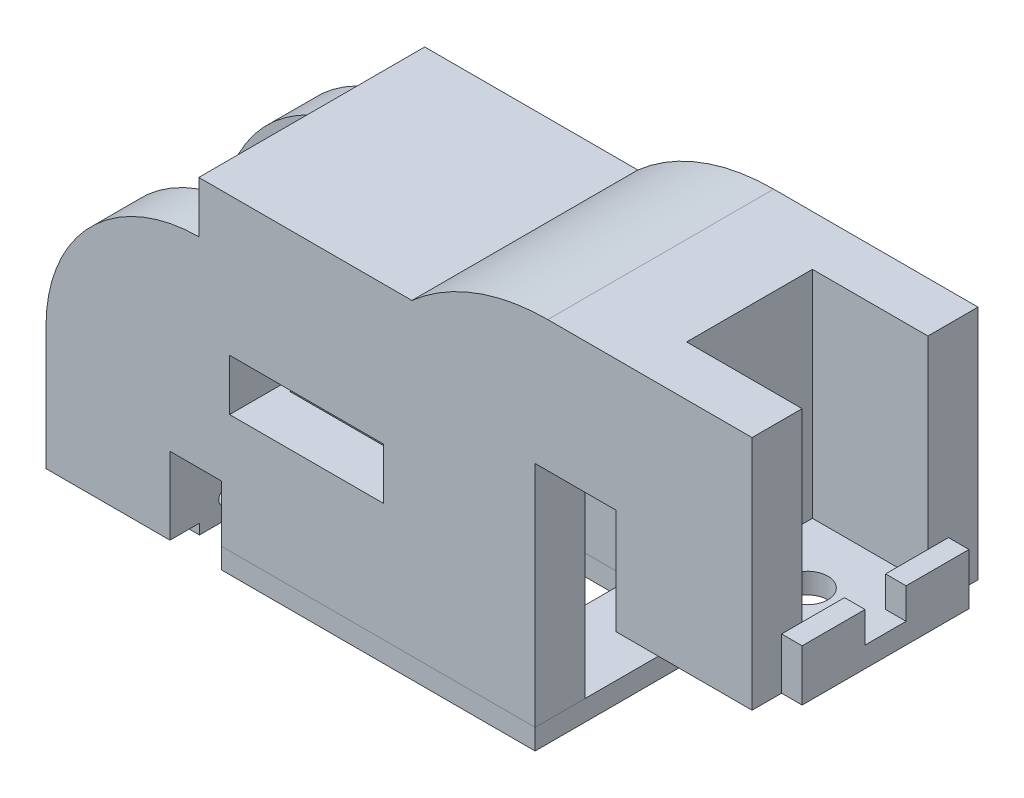
from build123d import *

# Parameters (mm, degrees)
SKETCH1_W              = 47.63
SKETCH1_H              = 22
SKETCH1_W_2            = 5.25
SKETCH1_H_2            = 12.25
BOSS_EXTRUDE1_DEPTH    = 2
SKETCH3_W              = 32.75
SKETCH3_H              = 22
BOSS_EXTRUDE2_DEPTH    = 30
SKETCH2_W              = 28.75
SKETCH2_H              = 12.25
CUT_EXTRUDE1_DEPTH     = 22.25
BOSS_EXTRUDE7_DEPTH    = 25
SKETCH19_W             = 16.25
SKETCH19_H             = 2
BOSS_EXTRUDE8_DEPTH    = 2
SKETCH20_W             = 2
SKETCH20_H             = 16.25
BOSS_EXTRUDE9_DEPTH    = 3
SKETCH39_W             = 4
SKETCH39_H             = 3
CUT_EXTRUDE16_DEPTH    = 2
BOSS_EXTRUDE11_DEPTH   = 28.03
SKETCH10_W             = 5
SKETCH10_H             = 22
CUT_EXTRUDE6_DEPTH     = 7.5
SKETCH21_R             = 0.75
CUT_EXTRUDE12_DEPTH    = 10
SKETCH21_5_R           = 0.75
CUT_EXTRUDE13_DEPTH    = 46.595105
SKETCH10_3_W           = 5
SKETCH10_3_H           = 2.875
SKETCH10_3_H_2         = 3.25
SKETCH10_3_H_3         = 9.75
CUT_EXTRUDE14_DEPTH    = 43.560712224
SKETCH25_W             = 14
SKETCH25_H             = 5
SKETCH25_W_2           = 1
CUT_EXTRUDE15_DEPTH    = 47.630614675
FILLET2_R              = 15
SKETCH29_W             = 9.875
SKETCH29_H             = 22
BOSS_EXTRUDE12_DEPTH   = 7.75
SKETCH30_W             = 11.25
SKETCH30_H             = 4.875
BOSS_EXTRUDE13_DEPTH   = 16
SKETCH36_W             = 13.25
SKETCH36_H             = 22
SKETCH36_R             = 2
BOSS_EXTRUDE16_DEPTH   = 2
SKETCH30_4_W           = 11.25
SKETCH30_4_H           = 4.875
BOSS_EXTRUDE18_DEPTH   = 5
BOSS_EXTRUDE19_DEPTH   = 2
SKETCH29_3_W           = 9.875
SKETCH29_3_H           = 22
BOSS_EXTRUDE20_DEPTH   = 5
SKETCH40_W             = 12
SKETCH40_H             = 22
BOSS_EXTRUDE21_DEPTH   = 5
FILLET5_R              = 20
SPLIT2_SURFACE_1_BACK  = 85.978
SPLIT2_SURFACE_1_DEPTH = 171.956
SPLIT2_SURFACE_2_BACK  = 85.978
SPLIT2_SURFACE_2_DEPTH = 171.956
SKETCH45_R             = 2
CUT_EXTRUDE17_DEPTH    = 60.57653565


with BuildPart() as part:
    # Sketch1 → Boss-Extrude1 (new body)
    with BuildSketch(Plane(origin=(0, 0, 0), x_dir=(1, 0, 0), z_dir=(0, 1, 0))):
        Rectangle(SKETCH1_W, SKETCH1_H)
        with Locations((13.315, 0)):
            Rectangle(SKETCH1_W_2, SKETCH1_H_2, mode=Mode.SUBTRACT)
    extrude(amount=BOSS_EXTRUDE1_DEPTH)

    # Sketch3 → Boss-Extrude2 (add)
    with BuildSketch(Plane(origin=(0, 2, 0), x_dir=(1, 0, 0), z_dir=(0, 1, 0))):
        with Locations((7.44, 0)):
            Rectangle(SKETCH3_W, SKETCH3_H)
    extrude(amount=BOSS_EXTRUDE2_DEPTH)

    # Sketch2 → Cut-Extrude1 (cut)
    with BuildSketch(Plane(origin=(0, 2, 0), x_dir=(1, 0, 0), z_dir=(0, 1, 0))):
        with Locations((9.44, 0)):
            Rectangle(SKETCH2_W, SKETCH2_H)
    extrude(amount=CUT_EXTRUDE1_DEPTH, mode=Mode.SUBTRACT)

    # Sketch18 → Boss-Extrude7 (add)
    with BuildSketch(Plane(origin=(0, 2, 0), x_dir=(1, 0, 0), z_dir=(0, 1, 0))):
        Polygon((-23.815, 11), (-23.815, 6.125), (-12.565, 6.125), (-12.565, -6.125), (-23.815, -6.125), (-23.815, -11), (-8.935, -11), (-8.935, 11), align=None)
    extrude(amount=BOSS_EXTRUDE7_DEPTH)

    # Sketch19 → Boss-Extrude8 (add)
    with BuildSketch(Plane.ZY.offset(23.815)):
        with Locations((0, 1)):
            Rectangle(SKETCH19_W, SKETCH19_H)
    extrude(amount=BOSS_EXTRUDE8_DEPTH)

    # Sketch20 → Boss-Extrude9 (add)
    with BuildSketch(Plane(origin=(0, 2, 0), x_dir=(1, 0, 0), z_dir=(0, 1, 0))):
        with Locations((-24.815, 0)):
            Rectangle(SKETCH20_W, SKETCH20_H)
    extrude(amount=BOSS_EXTRUDE9_DEPTH)

    # Sketch39 → Cut-Extrude16 (cut)
    with BuildSketch(Plane.ZY.offset(25.815)):
        with Locations((0, 3.5)):
            Rectangle(SKETCH39_W, SKETCH39_H)
    extrude(amount=-CUT_EXTRUDE16_DEPTH, mode=Mode.SUBTRACT)

    # Sketch24 → Boss-Extrude11 (add)
    with BuildSketch(Plane.ZY.offset(25.815)):
        Polygon((-8.125, 0), (-8.125, -1), (-4.875, -1), (-4.875, 0), (-4.875, 0.25), (-8.125, 0.25), align=None)
        Polygon((8.125, 0), (8.125, 0.25), (4.875, 0.25), (4.875, 0), (4.875, -1), (8.125, -1), align=None)
    extrude(amount=-BOSS_EXTRUDE11_DEPTH)

    # Sketch10 → Cut-Extrude6 (cut)
    with BuildSketch(Plane.XZ):
        with Locations((-9.245, 0)):
            Rectangle(SKETCH10_W, SKETCH10_H)
    extrude(amount=-CUT_EXTRUDE6_DEPTH, mode=Mode.SUBTRACT)

    # Sketch21 → Cut-Extrude12 (cut)
    with BuildSketch(Plane.ZY.offset(6.745)):
        with Locations((5.5, 1)):
            Circle(SKETCH21_R)
        with Locations(Location((-5.5, 1, 0), (0, 0, 180))):
            Circle(SKETCH21_R)
    extrude(amount=-CUT_EXTRUDE12_DEPTH, mode=Mode.SUBTRACT)

    # Sketch21<5> → Cut-Extrude13 (cut, through all)
    with BuildSketch(Plane.ZY.offset(6.745)):
        with Locations((5.5, 1)):
            Circle(SKETCH21_5_R)
        with Locations(Location((-5.5, 1, 0), (0, 0, 180))):
            Circle(SKETCH21_5_R)
    extrude(amount=CUT_EXTRUDE13_DEPTH, mode=Mode.SUBTRACT)

    # Sketch10<3> → Cut-Extrude14 (cut, through all)
    with BuildSketch(Plane.XZ):
        with Locations((-9.245, -9.5625)):
            Rectangle(SKETCH10_3_W, SKETCH10_3_H)
        with Locations((-9.245, -6.5)):
            Rectangle(SKETCH10_3_W, SKETCH10_3_H_2)
        with Locations((-9.245, 0)):
            Rectangle(SKETCH10_3_W, SKETCH10_3_H_3)
        with Locations((-9.245, 6.5)):
            Rectangle(SKETCH10_3_W, SKETCH10_3_H_2)
        with Locations((-9.245, 9.5625)):
            Rectangle(SKETCH10_3_W, SKETCH10_3_H)
    extrude(amount=CUT_EXTRUDE14_DEPTH, mode=Mode.SUBTRACT)

    # Sketch25 → Cut-Extrude15 (cut, through all)
    with BuildSketch(Plane.XY.offset(11)):
        with Locations((2.065, 16)):
            Rectangle(SKETCH25_W, SKETCH25_H)
        with Locations((-5.435, 16)):
            Rectangle(SKETCH25_W_2, SKETCH25_H)
    extrude(amount=-CUT_EXTRUDE15_DEPTH, mode=Mode.SUBTRACT)

    # Fillet2
    # the kernel refuses this fillet: 15 mm, written as the material it takes off along each edge
    with BuildSketch(Plane(origin=(-23.815, 27, -31.375), x_dir=(1, 0, 0), z_dir=(0, 0, 1))) as fillet2_piece_1_section:
        with BuildLine():
            CenterArc((FILLET2_R, -FILLET2_R), FILLET2_R, 90, 90)
            Line((0, -FILLET2_R), (0, 0))
            Line((0, 0), (FILLET2_R, 0))
        make_face()
    fillet2_piece_1 = extrude(amount=79.875, mode=Mode.PRIVATE)
    fillet2_piece_1 = split(fillet2_piece_1, bisect_by=Plane(origin=(-8.935, 23.601845872, 8.5625), z_dir=(-1, 0, 0)), keep=Keep.TOP, mode=Mode.PRIVATE)
    add(fillet2_piece_1, mode=Mode.SUBTRACT)

    # Sketch29 → Boss-Extrude12 (add)
    with BuildSketch(Plane(origin=(0, 32, 0), x_dir=(1, 0, 0), z_dir=(0, 1, 0))):
        with Locations((28.7525, 0)):
            Rectangle(SKETCH29_W, SKETCH29_H)
    extrude(amount=-BOSS_EXTRUDE12_DEPTH)

    # Sketch30 → Boss-Extrude13 (add)
    with BuildSketch(Plane(origin=(0, 32, 0), x_dir=(1, 0, 0), z_dir=(0, 1, 0))):
        Polygon((33.69, 6.125), (33.69, 11), (31.69, 11), (31.69, -11), (33.69, -11), (33.69, -6.125), align=None)
        with Locations((39.315, 8.5625)):
            Rectangle(SKETCH30_W, SKETCH30_H)
        with Locations((39.315, -8.5625)):
            Rectangle(SKETCH30_W, SKETCH30_H)
    extrude(amount=-BOSS_EXTRUDE13_DEPTH)

    # Sketch36 → Boss-Extrude16 (add)
    with BuildSketch(Plane.XZ.offset(-16)):
        with Locations((38.315, 0)):
            Rectangle(SKETCH36_W, SKETCH36_H)
        with Locations(Location((39.315, 0, 0), (0, 0, 270))):
            Circle(SKETCH36_R, mode=Mode.SUBTRACT)
    extrude(amount=BOSS_EXTRUDE16_DEPTH)

    # Sketch30<4> → Boss-Extrude18 (add)
    with BuildSketch(Plane(origin=(0, 32, 0), x_dir=(1, 0, 0), z_dir=(0, 1, 0))):
        with Locations((39.315, 8.5625)):
            Rectangle(SKETCH30_4_W, SKETCH30_4_H)
        Polygon((33.69, 6.125), (33.69, 11), (31.69, 11), (31.69, -11), (33.69, -11), (33.69, -6.125), align=None)
        with Locations((39.315, -8.5625)):
            Rectangle(SKETCH30_4_W, SKETCH30_4_H)
    extrude(amount=BOSS_EXTRUDE18_DEPTH)

    # Sketch38 → Boss-Extrude19 (add)
    with BuildSketch(Plane(origin=(44.94, 0, 0), x_dir=(0, 0, -1), z_dir=(1, 0, 0))):
        Polygon((-8.125, 19), (-2, 19), (-2, 16), (2, 16), (2, 19), (8.125, 19), (8.125, 14), (-8.125, 14), align=None)
    extrude(amount=BOSS_EXTRUDE19_DEPTH)

    # Sketch29<3> → Boss-Extrude20 (add)
    with BuildSketch(Plane(origin=(0, 32, 0), x_dir=(1, 0, 0), z_dir=(0, 1, 0))):
        with Locations((28.7525, 0)):
            Rectangle(SKETCH29_3_W, SKETCH29_3_H)
    extrude(amount=BOSS_EXTRUDE20_DEPTH)

    # Sketch40 → Boss-Extrude21 (add)
    with BuildSketch(Plane(origin=(0, 32, 0), x_dir=(1, 0, 0), z_dir=(0, 1, 0))):
        with Locations((17.815, 0)):
            Rectangle(SKETCH40_W, SKETCH40_H)
    extrude(amount=BOSS_EXTRUDE21_DEPTH)

    # Fillet5
    # the kernel refuses this fillet: 20 mm, written as the material it takes off along each edge
    with BuildSketch(Plane(origin=(11.815, 37, -44.071891388), x_dir=(0, -1, 0), z_dir=(0, 0, 1))) as fillet5_piece_1:
        with BuildLine():
            CenterArc((20, 13.228756555), FILLET5_R, 180, 41.409622109)
            Line((0, 13.228756555), (-0.4, 13.228756555))
            Line((-0.4, 13.228756555), (-0.4, 0))
            Line((-0.4, 0), (0, -0.4))
            ThreePointArc((0, -0.4), (2.5, -0.4), (4.7, -0.264575131))
            Line((4.7, -0.264575131), (5, 0))
        make_face()
    extrude(amount=88.143782777, mode=Mode.SUBTRACT)


with BuildPart() as body_2:
    # Split2: the piece behind the surface
    add(part.part)
    # Split2 surface: a surface, the sketch's curves swept straight by 171.956 mm
    with BuildLine(Plane.XY.offset(11).offset(-SPLIT2_SURFACE_1_BACK), mode=Mode.PRIVATE) as split2_surface_1_path:
        Line((-6.745, 2), (23.815, 2))
    split2_surface_1 = Shell.extrude(split2_surface_1_path.wire(), (0 * SPLIT2_SURFACE_1_DEPTH, 0 * SPLIT2_SURFACE_1_DEPTH, 1 * SPLIT2_SURFACE_1_DEPTH))
    split(bisect_by=split2_surface_1, keep=Keep.BOTTOM)


with BuildPart() as part_1:
    add(part.part)

    # Split2: split by a surface, the side it looks to stays
    # Split2 surface: a surface, the sketch's curves swept straight by 171.956 mm
    with BuildLine(Plane.XY.offset(11).offset(-SPLIT2_SURFACE_2_BACK), mode=Mode.PRIVATE) as split2_surface_2_path:
        Line((-6.745, 2), (23.815, 2))
    split2_surface_2 = Shell.extrude(split2_surface_2_path.wire(), (0 * SPLIT2_SURFACE_2_DEPTH, 0 * SPLIT2_SURFACE_2_DEPTH, 1 * SPLIT2_SURFACE_2_DEPTH))
    split(bisect_by=split2_surface_2, keep=Keep.TOP)

    # Sketch45 → Cut-Extrude17 (cut, through all)
    with BuildSketch(Plane(origin=(0, 2, 0), x_dir=(1, 0, 0), z_dir=(0, 1, 0))):
        with Locations(Location((-18.19, 0, 0), (0, 0, 270))):
            Circle(SKETCH45_R)
    extrude(amount=-CUT_EXTRUDE17_DEPTH, mode=Mode.SUBTRACT)


solid = Compound([body_2.part, part_1.part])
